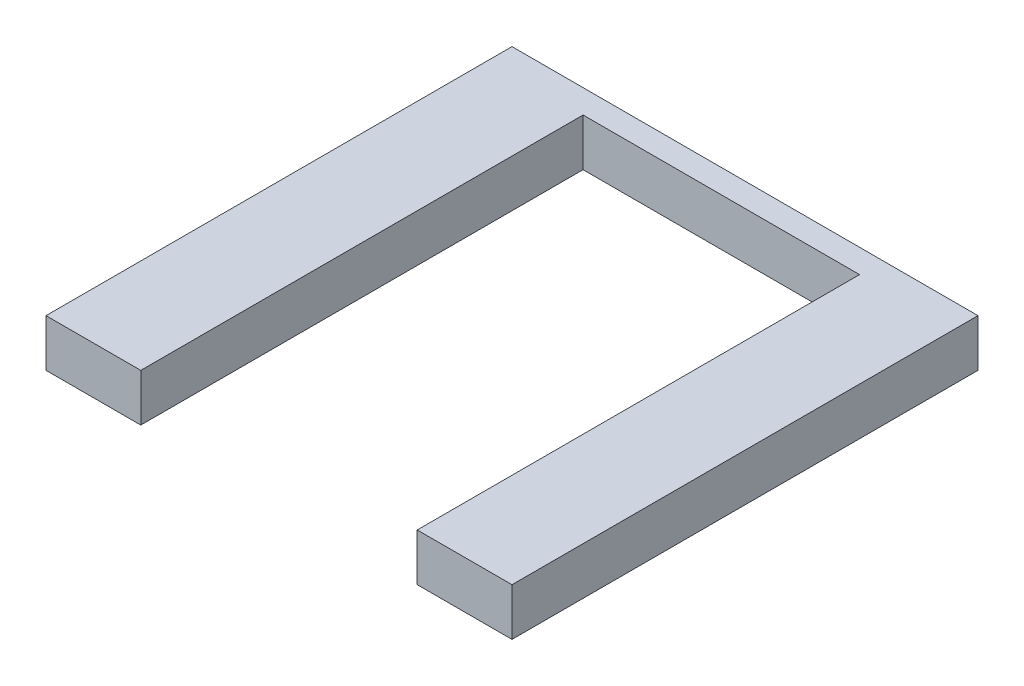
from build123d import *

# Parameters (mm, degrees)
SKETCH1_W           = 749.3
SKETCH1_H           = 749.3
BOSS_EXTRUDE1_DEPTH = 76.2
SKETCH2_W           = 444.5
SKETCH2_H           = 711.2
CUT_EXTRUDE1_DEPTH  = 76.2


with BuildPart() as part:
    # Sketch1 → Boss-Extrude1 (new body)
    with BuildSketch(Plane(origin=(0, 0, 0), x_dir=(1, 0, 0), z_dir=(0, 1, 0))):
        with Locations((374.65, -374.65)):
            Rectangle(SKETCH1_W, SKETCH1_H)
    extrude(amount=BOSS_EXTRUDE1_DEPTH)

    # Sketch2 → Cut-Extrude1 (cut)
    with BuildSketch(Plane(origin=(0, 76.2, 0), x_dir=(1, 0, 0), z_dir=(0, 1, 0))):
        with Locations((374.65, -393.7)):
            Rectangle(SKETCH2_W, SKETCH2_H)
    extrude(amount=-CUT_EXTRUDE1_DEPTH, mode=Mode.SUBTRACT)


solid = part.part
